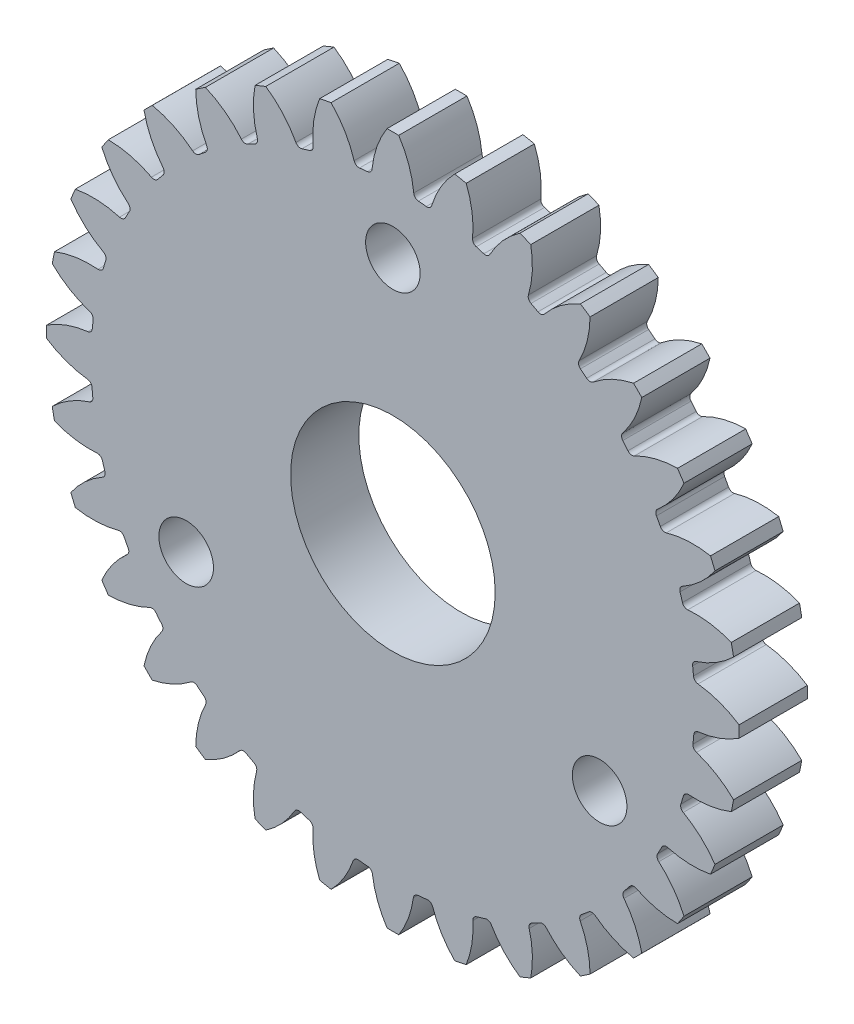
from build123d import *

# Parameters (mm, degrees)
SKETCH_1_R               = 22.125
EXTRUDE_1_DEPTH          = 5
EXTRUDE_2_DEPTH          = 5
FILLET_1_R               = 0.375
PATTERN_CIRCULAR_1_DEPTH = 5
CUT_EXTRUDE_1_REACH      = 38.324
SKETCH_2_R               = 7.5
SKETCH_2_R_2             = 2
PATTERN_CIRCULAR_2_COUNT = 3


# Read off the part's stored shape, not the designer's step: 원형 패턴1
with BuildPart() as part:
    # 스케치1 → 보스-돌출1 (new body)
    with BuildSketch(Plane.XY):
        Circle(SKETCH_1_R)
    extrude(amount=EXTRUDE_1_DEPTH)

    # 스케치1<3> → 보스-돌출2 (add)
    with BuildSketch(Plane.XY):
        with BuildLine():
            ThreePointArc((1.5525, 22.070463719), (1.21585383, 23.857604943), (0.4275, 25.496416292))
            ThreePointArc((0.4275, 25.496416292), (0, 25.5), (-0.4275, 25.496416292))
            ThreePointArc((-0.4275, 25.496416292), (-1.21585383, 23.857604943), (-1.5525, 22.070463719))
            ThreePointArc((-1.5525, 22.070463719), (0, 22.125), (1.5525, 22.070463719))
        make_face()
    extrude(amount=EXTRUDE_2_DEPTH)

    # 필렛1
    fillet_1_edges = [part.edges().sort_by_distance(p)[0] for p in [
        (-1.5525, 22.070463719, 2.5),
        (1.5525, 22.070463719, 2.5),
    ]]
    fillet(fillet_1_edges, radius=FILLET_1_R)

    # 원형 패턴1 outline → 원형 패턴1 (add)
    with BuildSketch(Plane.XY):
        with BuildLine():
            ThreePointArc((2.444283435, 21.98956806), (4.293588924, 21.704394005), (6.112184567, 21.263979515))
            ThreePointArc((6.112184567, 21.263979515), (5.905769655, 21.413393015), (5.842497848, 21.660229374))
            ThreePointArc((5.842497848, 21.660229374), (5.802654343, 23.32123269), (5.370053117, 24.92540715))
            ThreePointArc((5.370053117, 24.92540715), (4.951466557, 25.01232311), (4.531481703, 25.092209375))
            ThreePointArc((4.531481703, 25.092209375), (3.516946773, 23.774058474), (2.84435724, 22.252734629))
            ThreePointArc((2.84435724, 22.252734629), (2.691796357, 22.048976858), (2.444283435, 21.98956806))
        make_face()
        with BuildLine():
            ThreePointArc((6.666619461, 21.0967251), (8.424754042, 20.458229257), (10.122674393, 19.673512349))
            ThreePointArc((10.122674393, 19.673512349), (9.949192224, 19.860116616), (9.934998054, 20.114509502))
            ThreePointArc((9.934998054, 20.114509502), (10.217786423, 21.747544593), (10.106238105, 23.401125508))
            ThreePointArc((10.106238105, 23.401125508), (9.712651031, 23.56803359), (9.316321105, 23.728319843))
            ThreePointArc((9.316321105, 23.728319843), (8.065688244, 22.635164018), (7.109877676, 21.276672808))
            ThreePointArc((7.109877676, 21.276672808), (6.920669662, 21.106837331), (6.666619461, 21.0967251))
        make_face()
        with BuildLine():
            ThreePointArc((10.637215679, 19.400135762), (12.236924822, 18.432940512), (13.749277459, 17.334156869))
            ThreePointArc((13.749277459, 17.334156869), (13.615350812, 17.550745341), (13.650644172, 17.802938306))
            ThreePointArc((13.650644172, 17.802938306), (14.242359023, 19.344526043), (14.45404603, 20.982148657))
            ThreePointArc((14.45404603, 20.982148657), (14.100583772, 21.222634676), (13.743139511, 21.457161206))
            ThreePointArc((13.743139511, 21.457161206), (12.306838953, 20.631658701), (11.106467915, 19.489939361))
            ThreePointArc((11.106467915, 19.489939361), (10.887994282, 19.360635713), (10.637215679, 19.400135762))
        make_face()
        with BuildLine():
            ThreePointArc((14.204936343, 16.962765355), (15.585070274, 15.704178092), (16.854128337, 14.33366607))
            ThreePointArc((16.854128337, 14.33366607), (16.764821309, 14.571883643), (16.848096194, 14.812276344))
            ThreePointArc((16.848096194, 14.812276344), (17.72266337, 16.203684458), (18.246393072, 17.76143652))
            ThreePointArc((18.246393072, 17.76143652), (17.946638987, 18.066258733), (17.641816774, 18.366012818))
            ThreePointArc((17.641816774, 18.366012818), (16.077838182, 17.839327127), (14.681942355, 16.959042118))
            ThreePointArc((14.681942355, 16.959042118), (14.442771029, 16.875281275), (14.204936343, 16.962765355))
        make_face()
        with BuildLine():
            ThreePointArc((17.23316378, 13.875651017), (18.341049205, 12.374228826), (19.318483962, 10.784794963))
            ThreePointArc((19.318483962, 10.784794963), (19.277111642, 11.035473468), (19.405032293, 11.254990413))
            ThreePointArc((19.405032293, 11.254990413), (20.525515383, 12.444582496), (21.337541461, 13.862759257))
            ThreePointArc((21.337541461, 13.862759257), (21.10301493, 14.220203518), (20.862528911, 14.573665776))
            ThreePointArc((20.862528911, 14.573665776), (19.233698347, 14.364194467), (17.699368241, 13.778704622))
            ThreePointArc((17.699368241, 13.778704622), (17.448903967, 13.74368568), (17.23316378, 13.875651017))
        make_face()
        with BuildLine():
            ThreePointArc((19.604964477, 10.254803403), (20.398452702, 8.568474331), (21.047204906, 6.821348154))
            ThreePointArc((21.047204906, 6.821348154), (21.055215407, 7.07487041), (21.222770502, 7.265298855))
            ThreePointArc((21.222770502, 7.265298855), (22.54328999, 8.210414093), (23.608700097, 9.43594085))
            ThreePointArc((23.608700097, 9.43594085), (23.448413844, 9.832270776), (23.281505763, 10.225857851))
            ThreePointArc((23.281505763, 10.225857851), (21.652584428, 10.338647109), (20.042246813, 10.068612114))
            ThreePointArc((20.042246813, 10.068612114), (19.790342871, 10.083587973), (19.604964477, 10.254803403))
        make_face()
        with BuildLine():
            ThreePointArc((21.227659819, 6.237153486), (21.676765844, 4.430964629), (21.972478136, 2.59342044))
            ThreePointArc((21.972478136, 2.59342044), (22.029410154, 2.840097121), (22.230125273, 2.994382832))
            ThreePointArc((22.230125273, 2.994382832), (23.698043896, 3.662691346), (24.972589629, 4.651101448))
            ThreePointArc((24.972589629, 4.651101448), (24.892703364, 5.071086302), (24.805787404, 5.489672863))
            ThreePointArc((24.805787404, 5.489672863), (23.240578184, 5.916523463), (21.619064629, 5.969202918))
            ThreePointArc((21.619064629, 5.969202918), (21.375614895, 6.033432001), (21.227659819, 6.237153486))
        make_face()
        with BuildLine():
            ThreePointArc((22.036616892, 1.975636845), (22.124678801, 0.119218153), (22.056627935, -1.738041748))
            ThreePointArc((22.056627935, -1.738041748), (22.160143507, -1.507598022), (22.386340823, -1.395105539))
            ThreePointArc((22.386340823, -1.395105539), (23.944570362, -1.024781477), (25.376796547, -0.307880254))
            ThreePointArc((25.376796547, -0.307880254), (25.380380254, 0.119619746), (25.376796547, 0.547119746))
            ThreePointArc((25.376796547, 0.547119746), (23.935432495, 1.267335951), (22.36703156, 1.636605795))
            ThreePointArc((22.36703156, 1.636605795), (22.141563156, 1.747391769), (22.036616892, 1.975636845))
        make_face()
        with BuildLine():
            ThreePointArc((21.998080207, -2.366451395), (21.722388331, -4.201603288), (21.29387741, -6.007196506))
            ThreePointArc((21.29387741, -6.007196506), (21.439866375, -5.801714546), (21.682959992, -5.735072913))
            ThreePointArc((21.682959992, -5.735072913), (23.272260054, -5.672441899), (24.805787404, -5.250433372))
            ThreePointArc((24.805787404, -5.250433372), (24.892703364, -4.831846811), (24.972589629, -4.411861957))
            ThreePointArc((24.972589629, -4.411861957), (23.709149885, -3.43017512), (22.254829489, -2.763135975))
            ThreePointArc((22.254829489, -2.763135975), (22.056115926, -2.610319699), (21.998080207, -2.366451395))
        make_face()
        with BuildLine():
            ThreePointArc((21.110882023, -6.621652755), (20.482752043, -8.364956291), (19.71094801, -10.049584745))
            ThreePointArc((19.71094801, -10.049584745), (19.893697953, -9.87680877), (20.14451354, -9.858352866))
            ThreePointArc((20.14451354, -9.858352866), (21.705678583, -10.101781735), (23.281505763, -9.986618359))
            ThreePointArc((23.281505763, -9.986618359), (23.448413844, -9.593031285), (23.608700097, -9.196701359))
            ThreePointArc((23.608700097, -9.196701359), (22.569257668, -7.994919475), (21.284214484, -7.060369168))
            ThreePointArc((21.284214484, -7.060369168), (21.119927454, -6.871678162), (21.110882023, -6.621652755))
        make_face()
        with BuildLine():
            ThreePointArc((19.406900344, -10.62486913), (18.451191556, -12.209387993), (17.366419791, -13.708504245))
            ThreePointArc((17.366419791, -13.708504245), (17.578843089, -13.574909628), (17.827951011, -13.605182093))
            ThreePointArc((17.827951011, -13.605182093), (19.303813682, -14.142189891), (20.862528911, -14.334426284))
            ThreePointArc((20.862528911, -14.334426284), (21.10301493, -13.980964026), (21.337541461, -13.623519766))
            ThreePointArc((21.337541461, -13.623519766), (20.558699666, -12.250501719), (19.490347943, -11.088435587))
            ThreePointArc((19.490347943, -11.088435587), (19.366762894, -10.871388379), (19.406900344, -10.62486913))
        make_face()
        with BuildLine():
            ThreePointArc((16.950180728, -14.219950714), (15.704287436, -15.584960094), (14.348820513, -16.841228426))
            ThreePointArc((14.348820513, -16.841228426), (14.582728556, -16.751788122), (14.820780557, -16.829529911))
            ThreePointArc((14.820780557, -16.829529911), (16.15799263, -17.637565788), (17.641816774, -18.126773326))
            ThreePointArc((17.641816774, -18.126773326), (17.946638987, -17.827019241), (18.246393072, -17.522197028))
            ThreePointArc((18.246393072, -17.522197028), (17.754320073, -16.032149616), (16.940780061, -14.690311409))
            ThreePointArc((16.940780061, -14.690311409), (16.8625468, -14.453473544), (16.950180728, -14.219950714))
        make_face()
        with BuildLine():
            ThreePointArc((13.8346996, -17.266056642), (12.347067062, -18.359345303), (10.773466099, -19.324804093))
            ThreePointArc((10.773466099, -19.324804093), (11.019879813, -19.282812425), (11.23794008, -19.405012011))
            ThreePointArc((11.23794008, -19.405012011), (12.388522161, -20.452441629), (13.743139511, -21.217921715))
            ThreePointArc((13.743139511, -21.217921715), (14.100583772, -20.983395184), (14.45404603, -20.742909166))
            ThreePointArc((14.45404603, -20.742909166), (14.263976267, -19.193236454), (13.733070589, -17.724988794))
            ThreePointArc((13.733070589, -17.724988794), (13.703055858, -17.47762335), (13.8346996, -17.266056642))
        make_face()
        with BuildLine():
            ThreePointArc((10.180818838, -19.643486269), (8.509053227, -20.423311146), (6.778135903, -21.061160905))
            ThreePointArc((6.778135903, -21.061160905), (7.027621197, -21.068119163), (7.217483275, -21.230118301))
            ThreePointArc((7.217483275, -21.230118301), (8.140156862, -22.477360442), (9.316321105, -23.489080352))
            ThreePointArc((9.316321105, -23.489080352), (9.712651031, -23.328794099), (10.106238105, -23.161886017))
            ThreePointArc((10.106238105, -23.161886017), (10.222380819, -21.611116982), (9.991103394, -20.07329889))
            ThreePointArc((9.991103394, -20.07329889), (10.010308106, -19.825000018), (10.180818838, -19.643486269))
        make_face()
        with BuildLine():
            ThreePointArc((6.130557784, -21.258689665), (4.339211302, -21.695319087), (2.517730048, -21.981279772))
            ThreePointArc((2.517730048, -21.981279772), (2.760746743, -22.036846106), (2.915228107, -22.232499471))
            ThreePointArc((2.915228107, -22.232499471), (3.57655537, -23.633277687), (4.531481703, -24.852969884))
            ThreePointArc((4.531481703, -24.852969884), (4.951466557, -24.773083619), (5.370053117, -24.686167658))
            ThreePointArc((5.370053117, -24.686167658), (5.785834439, -23.192020923), (5.860226722, -21.642887501))
            ThreePointArc((5.860226722, -21.642887501), (5.927776723, -21.40321263), (6.130557784, -21.258689665))
        make_face()
        with BuildLine():
            ThreePointArc((1.841881972, -22.048199378), (0, -22.125), (-1.841881972, -22.048199378))
            ThreePointArc((-1.841881972, -22.048199378), (-1.614629067, -22.150203696), (-1.50142289, -22.372089084))
            ThreePointArc((-1.50142289, -22.372089084), (-1.126066567, -23.874787592), (-0.4275, -25.257176801))
            ThreePointArc((-0.4275, -25.257176801), (0, -25.260760509), (0.4275, -25.257176801))
            ThreePointArc((0.4275, -25.257176801), (1.126066567, -23.874787592), (1.50142289, -22.372089084))
            ThreePointArc((1.50142289, -22.372089084), (1.614629067, -22.150203696), (1.841881972, -22.048199378))
        make_face()
        with BuildLine():
            ThreePointArc((-2.517730048, -21.981279772), (-4.339211302, -21.695319087), (-6.130557784, -21.258689665))
            ThreePointArc((-6.130557784, -21.258689665), (-5.927776723, -21.40321263), (-5.860226722, -21.642887501))
            ThreePointArc((-5.860226722, -21.642887501), (-5.785834439, -23.192020923), (-5.370053117, -24.686167658))
            ThreePointArc((-5.370053117, -24.686167658), (-4.951466557, -24.773083619), (-4.531481703, -24.852969884))
            ThreePointArc((-4.531481703, -24.852969884), (-3.57655537, -23.633277687), (-2.915228107, -22.232499471))
            ThreePointArc((-2.915228107, -22.232499471), (-2.760746743, -22.036846106), (-2.517730048, -21.981279772))
        make_face()
        with BuildLine():
            ThreePointArc((-6.778135903, -21.061160905), (-8.509053227, -20.423311146), (-10.180818838, -19.643486269))
            ThreePointArc((-10.180818838, -19.643486269), (-10.010308106, -19.825000018), (-9.991103394, -20.07329889))
            ThreePointArc((-9.991103394, -20.07329889), (-10.222380819, -21.611116982), (-10.106238105, -23.161886017))
            ThreePointArc((-10.106238105, -23.161886017), (-9.712651031, -23.328794099), (-9.316321105, -23.489080352))
            ThreePointArc((-9.316321105, -23.489080352), (-8.140156862, -22.477360442), (-7.217483275, -21.230118301))
            ThreePointArc((-7.217483275, -21.230118301), (-7.027621197, -21.068119163), (-6.778135903, -21.061160905))
        make_face()
        with BuildLine():
            ThreePointArc((-10.773466099, -19.324804093), (-12.347067062, -18.359345303), (-13.8346996, -17.266056642))
            ThreePointArc((-13.8346996, -17.266056642), (-13.703055858, -17.47762335), (-13.733070589, -17.724988794))
            ThreePointArc((-13.733070589, -17.724988794), (-14.263976267, -19.193236454), (-14.45404603, -20.742909166))
            ThreePointArc((-14.45404603, -20.742909166), (-14.100583772, -20.983395184), (-13.743139511, -21.217921715))
            ThreePointArc((-13.743139511, -21.217921715), (-12.388522161, -20.452441629), (-11.23794008, -19.405012011))
            ThreePointArc((-11.23794008, -19.405012011), (-11.019879813, -19.282812425), (-10.773466099, -19.324804093))
        make_face()
        with BuildLine():
            ThreePointArc((-14.348820513, -16.841228426), (-15.704287436, -15.584960094), (-16.950180728, -14.219950714))
            ThreePointArc((-16.950180728, -14.219950714), (-16.8625468, -14.453473544), (-16.940780061, -14.690311409))
            ThreePointArc((-16.940780061, -14.690311409), (-17.754320073, -16.032149616), (-18.246393072, -17.522197028))
            ThreePointArc((-18.246393072, -17.522197028), (-17.946638987, -17.827019241), (-17.641816774, -18.126773326))
            ThreePointArc((-17.641816774, -18.126773326), (-16.15799263, -17.637565788), (-14.820780557, -16.829529911))
            ThreePointArc((-14.820780557, -16.829529911), (-14.582728556, -16.751788122), (-14.348820513, -16.841228426))
        make_face()
        with BuildLine():
            ThreePointArc((-17.366419791, -13.708504245), (-18.451191556, -12.209387993), (-19.406900344, -10.62486913))
            ThreePointArc((-19.406900344, -10.62486913), (-19.366762894, -10.871388379), (-19.490347943, -11.088435587))
            ThreePointArc((-19.490347943, -11.088435587), (-20.558699666, -12.250501719), (-21.337541461, -13.623519766))
            ThreePointArc((-21.337541461, -13.623519766), (-21.10301493, -13.980964026), (-20.862528911, -14.334426284))
            ThreePointArc((-20.862528911, -14.334426284), (-19.303813682, -14.142189891), (-17.827951011, -13.605182093))
            ThreePointArc((-17.827951011, -13.605182093), (-17.578843089, -13.574909628), (-17.366419791, -13.708504245))
        make_face()
        with BuildLine():
            ThreePointArc((-19.71094801, -10.049584745), (-20.482752043, -8.364956291), (-21.110882023, -6.621652755))
            ThreePointArc((-21.110882023, -6.621652755), (-21.119927454, -6.871678162), (-21.284214484, -7.060369168))
            ThreePointArc((-21.284214484, -7.060369168), (-22.569257668, -7.994919475), (-23.608700097, -9.196701359))
            ThreePointArc((-23.608700097, -9.196701359), (-23.448413844, -9.593031285), (-23.281505763, -9.986618359))
            ThreePointArc((-23.281505763, -9.986618359), (-21.705678583, -10.101781735), (-20.14451354, -9.858352866))
            ThreePointArc((-20.14451354, -9.858352866), (-19.893697953, -9.87680877), (-19.71094801, -10.049584745))
        make_face()
        with BuildLine():
            ThreePointArc((-21.29387741, -6.007196506), (-21.722388331, -4.201603288), (-21.998080207, -2.366451395))
            ThreePointArc((-21.998080207, -2.366451395), (-22.056115926, -2.610319699), (-22.254829489, -2.763135975))
            ThreePointArc((-22.254829489, -2.763135975), (-23.709149885, -3.43017512), (-24.972589629, -4.411861957))
            ThreePointArc((-24.972589629, -4.411861957), (-24.892703364, -4.831846811), (-24.805787404, -5.250433372))
            ThreePointArc((-24.805787404, -5.250433372), (-23.272260054, -5.672441899), (-21.682959992, -5.735072913))
            ThreePointArc((-21.682959992, -5.735072913), (-21.439866375, -5.801714546), (-21.29387741, -6.007196506))
        make_face()
        with BuildLine():
            ThreePointArc((-22.056627935, -1.738041748), (-22.124678801, 0.119218153), (-22.036616892, 1.975636845))
            ThreePointArc((-22.036616892, 1.975636845), (-22.141563156, 1.747391769), (-22.36703156, 1.636605795))
            ThreePointArc((-22.36703156, 1.636605795), (-23.935432495, 1.267335951), (-25.376796547, 0.547119746))
            ThreePointArc((-25.376796547, 0.547119746), (-25.380380254, 0.119619746), (-25.376796547, -0.307880254))
            ThreePointArc((-25.376796547, -0.307880254), (-23.944570362, -1.024781477), (-22.386340823, -1.395105539))
            ThreePointArc((-22.386340823, -1.395105539), (-22.160143507, -1.507598022), (-22.056627935, -1.738041748))
        make_face()
        with BuildLine():
            ThreePointArc((-21.972478136, 2.59342044), (-21.676765844, 4.430964629), (-21.227659819, 6.237153486))
            ThreePointArc((-21.227659819, 6.237153486), (-21.375614895, 6.033432001), (-21.619064629, 5.969202918))
            ThreePointArc((-21.619064629, 5.969202918), (-23.240578184, 5.916523463), (-24.805787404, 5.489672863))
            ThreePointArc((-24.805787404, 5.489672863), (-24.892703364, 5.071086302), (-24.972589629, 4.651101448))
            ThreePointArc((-24.972589629, 4.651101448), (-23.698043896, 3.662691346), (-22.230125273, 2.994382832))
            ThreePointArc((-22.230125273, 2.994382832), (-22.029410154, 2.840097121), (-21.972478136, 2.59342044))
        make_face()
        with BuildLine():
            ThreePointArc((-21.047204906, 6.821348154), (-20.398452702, 8.568474331), (-19.604964477, 10.254803403))
            ThreePointArc((-19.604964477, 10.254803403), (-19.790342871, 10.083587973), (-20.042246813, 10.068612114))
            ThreePointArc((-20.042246813, 10.068612114), (-21.652584428, 10.338647109), (-23.281505763, 10.225857851))
            ThreePointArc((-23.281505763, 10.225857851), (-23.448413844, 9.832270776), (-23.608700097, 9.43594085))
            ThreePointArc((-23.608700097, 9.43594085), (-22.54328999, 8.210414093), (-21.222770502, 7.265298855))
            ThreePointArc((-21.222770502, 7.265298855), (-21.055215407, 7.07487041), (-21.047204906, 6.821348154))
        make_face()
        with BuildLine():
            ThreePointArc((-19.318483962, 10.784794963), (-18.341049205, 12.374228826), (-17.23316378, 13.875651017))
            ThreePointArc((-17.23316378, 13.875651017), (-17.448903967, 13.74368568), (-17.699368241, 13.778704622))
            ThreePointArc((-17.699368241, 13.778704622), (-19.233698347, 14.364194467), (-20.862528911, 14.573665776))
            ThreePointArc((-20.862528911, 14.573665776), (-21.10301493, 14.220203518), (-21.337541461, 13.862759257))
            ThreePointArc((-21.337541461, 13.862759257), (-20.525515383, 12.444582496), (-19.405032293, 11.254990413))
            ThreePointArc((-19.405032293, 11.254990413), (-19.277111642, 11.035473468), (-19.318483962, 10.784794963))
        make_face()
        with BuildLine():
            ThreePointArc((-16.854128337, 14.33366607), (-15.585070274, 15.704178092), (-14.204936343, 16.962765355))
            ThreePointArc((-14.204936343, 16.962765355), (-14.442771029, 16.875281275), (-14.681942355, 16.959042118))
            ThreePointArc((-14.681942355, 16.959042118), (-16.077838182, 17.839327127), (-17.641816774, 18.366012818))
            ThreePointArc((-17.641816774, 18.366012818), (-17.946638987, 18.066258733), (-18.246393072, 17.76143652))
            ThreePointArc((-18.246393072, 17.76143652), (-17.72266337, 16.203684458), (-16.848096194, 14.812276344))
            ThreePointArc((-16.848096194, 14.812276344), (-16.764821309, 14.571883643), (-16.854128337, 14.33366607))
        make_face()
        with BuildLine():
            ThreePointArc((-13.749277459, 17.334156869), (-12.236924822, 18.432940512), (-10.637215679, 19.400135762))
            ThreePointArc((-10.637215679, 19.400135762), (-10.887994282, 19.360635713), (-11.106467915, 19.489939361))
            ThreePointArc((-11.106467915, 19.489939361), (-12.306838953, 20.631658701), (-13.743139511, 21.457161206))
            ThreePointArc((-13.743139511, 21.457161206), (-14.100583772, 21.222634676), (-14.45404603, 20.982148657))
            ThreePointArc((-14.45404603, 20.982148657), (-14.242359023, 19.344526043), (-13.650644172, 17.802938306))
            ThreePointArc((-13.650644172, 17.802938306), (-13.615350812, 17.550745341), (-13.749277459, 17.334156869))
        make_face()
        with BuildLine():
            ThreePointArc((-10.122674393, 19.673512349), (-8.424754042, 20.458229257), (-6.666619461, 21.0967251))
            ThreePointArc((-6.666619461, 21.0967251), (-6.920669662, 21.106837331), (-7.109877676, 21.276672808))
            ThreePointArc((-7.109877676, 21.276672808), (-8.065688244, 22.635164018), (-9.316321105, 23.728319843))
            ThreePointArc((-9.316321105, 23.728319843), (-9.712651031, 23.56803359), (-10.106238105, 23.401125508))
            ThreePointArc((-10.106238105, 23.401125508), (-10.217786423, 21.747544593), (-9.934998054, 20.114509502))
            ThreePointArc((-9.934998054, 20.114509502), (-9.949192224, 19.860116616), (-10.122674393, 19.673512349))
        make_face()
        with BuildLine():
            ThreePointArc((-2.84435724, 22.252734629), (-3.516946773, 23.774058474), (-4.531481703, 25.092209375))
            ThreePointArc((-4.531481703, 25.092209375), (-4.951466557, 25.01232311), (-5.370053117, 24.92540715))
            ThreePointArc((-5.370053117, 24.92540715), (-5.802654343, 23.32123269), (-5.842497848, 21.660229374))
            ThreePointArc((-5.842497848, 21.660229374), (-5.905769655, 21.413393015), (-6.112184567, 21.263979515))
            ThreePointArc((-6.112184567, 21.263979515), (-4.293588924, 21.704394005), (-2.444283435, 21.98956806))
            ThreePointArc((-2.444283435, 21.98956806), (-2.691796357, 22.048976858), (-2.84435724, 22.252734629))
        make_face()
    extrude(amount=PATTERN_CIRCULAR_1_DEPTH)

    # 스케치2 → 컷-돌출1 (cut, up to next)
    with BuildSketch(Plane.XY.offset(5), mode=Mode.PRIVATE) as cut_extrude_1_sk1:
        Circle(SKETCH_2_R)
    cut_extrude_1_tool1 = extrude(cut_extrude_1_sk1.sketch, amount=-CUT_EXTRUDE_1_REACH, mode=Mode.PRIVATE) & part.part
    # 스케치2 → 컷-돌출1 (cut, up to next)
    with BuildSketch(Plane.XY.offset(5), mode=Mode.PRIVATE) as cut_extrude_1_sk2:
        with Locations((0, 17.5)):
            Circle(SKETCH_2_R_2)
    cut_extrude_1_tool2 = extrude(cut_extrude_1_sk2.sketch, amount=-CUT_EXTRUDE_1_REACH, mode=Mode.PRIVATE) & part.part
    cut_extrude_1_1 = cut_extrude_1_tool1.solids().sort_by_distance((0, 0, 5))[0]
    add(cut_extrude_1_1, mode=Mode.SUBTRACT)
    cut_extrude_1_2 = cut_extrude_1_tool2.solids().sort_by_distance((0, 17.5, 5))[0]
    add(cut_extrude_1_2, mode=Mode.SUBTRACT)
    cut_extrude_1 = cut_extrude_1_1 + cut_extrude_1_2  # 컷-돌출1 as one shape, for the pattern or mirror that repeats it

    # 원형 패턴2: 컷-돌출1 ×3 about axis
    pattern_circular_2_axis = Axis((0, 0, 0), (0, 0, 1))
    for i in range(1, PATTERN_CIRCULAR_2_COUNT):
        add(cut_extrude_1.rotate(pattern_circular_2_axis, i * 360 / PATTERN_CIRCULAR_2_COUNT), mode=Mode.SUBTRACT)


solid = part.part
